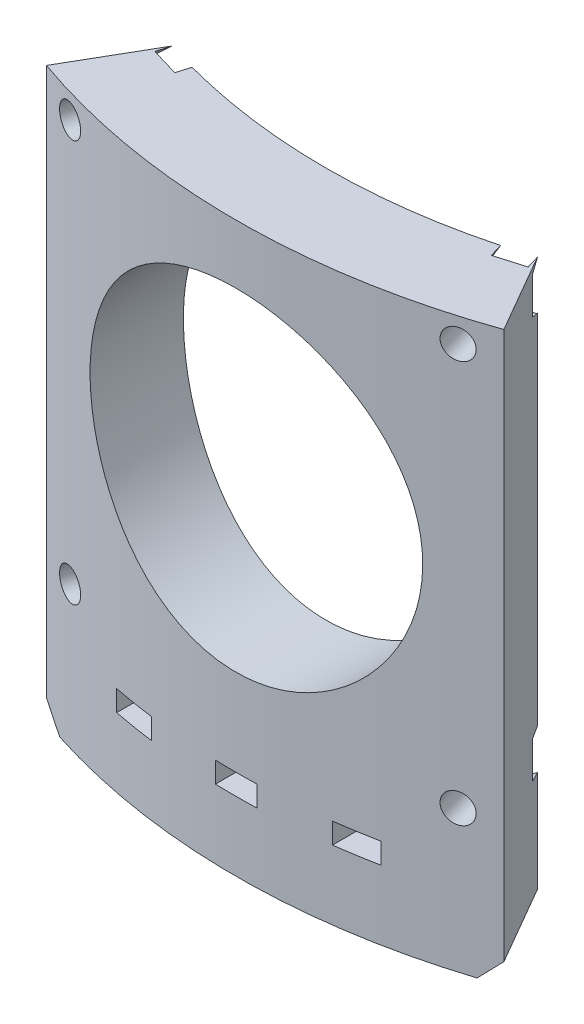
from build123d import *

# Parameters (mm, degrees)
EXTRUDE_1_DEPTH          = 82
SKETCH_2_R               = 1.75
CUT_EXTRUDE_1_DEPTH      = 20
SKETCH_3_W               = 6
SKETCH_3_H               = 3
CUT_EXTRUDE_2_DEPTH      = 91.038245833
SKETCH_4_R               = 24
CUT_EXTRUDE_3_DEPTH      = 91.038245833
CHAMFER_1_SIZE           = 3
SKETCH_10_R              = 2.25
CUT_EXTRUDE_5_DEPTH      = 104.037059953
SKETCH_11_R              = 2.1
CUT_EXTRUDE_6_DEPTH      = 104.037059953
CUT_EXTRUDE_7_DEPTH      = 2
CUT_EXTRUDE_7_DEPTH_BACK = 2
CUT_EXTRUDE_8_DEPTH      = 2
CUT_EXTRUDE_8_DEPTH_BACK = 2


with BuildPart() as part:
    # Эскиз1 → Бобышка-Вытянуть1 (new body)
    with BuildSketch(Plane(origin=(0, 0, 0), x_dir=(-1, 0, 0), z_dir=(0, 1, 0))):
        with BuildLine():
            Line((33, 7.338095117), (26.371331686, -4.14309519))
            ThreePointArc((26.371331686, -4.14309519), (0, 0), (-26.371331686, -4.14309519))
            Line((-26.371331686, -4.14309519), (-33, 7.338095117))
            ThreePointArc((-33, 7.338095117), (0, 13), (33, 7.338095117))
        make_face()
    extrude(amount=EXTRUDE_1_DEPTH)

    # Эскиз2 → Вырез-Вытянуть1 (cut)
    with BuildSketch(Plane.XZ):
        with Locations((0, 6.5)):
            Circle(SKETCH_2_R)
        with Locations((16.060870766, 5.085724384)):
            Circle(SKETCH_2_R)
        with Locations((-16.060870766, 5.085724384)):
            Circle(SKETCH_2_R)
    extrude(amount=-CUT_EXTRUDE_1_DEPTH, mode=Mode.SUBTRACT)

    # Эскиз3 → Вырез-Вытянуть2 (cut, through all)
    with BuildSketch(Plane.XY.offset(13)):
        with Locations((-16.060870766, 11.5)):
            Rectangle(SKETCH_3_W, SKETCH_3_H)
        with Locations((0, 11.5)):
            Rectangle(SKETCH_3_W, SKETCH_3_H)
        with Locations((16.060870766, 11.5)):
            Rectangle(SKETCH_3_W, SKETCH_3_H)
    extrude(amount=-CUT_EXTRUDE_2_DEPTH, mode=Mode.SUBTRACT)

    # Эскиз4 → Вырез-Вытянуть3 (cut, through all)
    with BuildSketch(Plane.XY.offset(13)):
        with Locations((0, 49.5)):
            Circle(SKETCH_4_R)
    extrude(amount=-CUT_EXTRUDE_3_DEPTH, mode=Mode.SUBTRACT)

    # Фаска1
    chamfer_1_edges = [part.edges().sort_by_distance(p)[0] for p in [
        (29.685665843, 0, 1.597499963),
        (-29.685665843, 0, 1.597499963),
    ]]
    chamfer(chamfer_1_edges, length=CHAMFER_1_SIZE)

    # Эскиз10 → Вырез-Вытянуть5 (cut, through all)
    with BuildSketch(Plane(origin=(-28, 82, 8.957885402), x_dir=(0.9591705596151331, 0, 0.28282828282827793), z_dir=(-0.28282828282827793, 0, 0.9591705596151331))):
        with Locations((0, -3.5)):
            Circle(SKETCH_10_R)
        with Locations((0, -61.5)):
            Circle(SKETCH_10_R)
    extrude(amount=-CUT_EXTRUDE_5_DEPTH, mode=Mode.SUBTRACT)

    # Эскиз11 → Вырез-Вытянуть6 (cut, through all)
    with BuildSketch(Plane(origin=(28, 82, 8.957885402), x_dir=(0.9591705596151305, 0, -0.28282828282828665), z_dir=(0.28282828282828665, 0, 0.9591705596151305))):
        with Locations((0, -3.5)):
            Circle(SKETCH_11_R)
        with Locations((0, -61.5)):
            Circle(SKETCH_11_R)
    extrude(amount=-CUT_EXTRUDE_6_DEPTH, mode=Mode.SUBTRACT)

    # Эскиз13 → Вырез-Вытянуть7 (cut, two sides: drawn at the far end of the back side and taken through both)
    with BuildSketch(Plane(origin=(-0.985550088, 0, 3.342348296), x_dir=(0.9591705596151331, 0, 0.28282828282827793), z_dir=(-0.28282828282827793, 0, 0.9591705596151331)).offset(-CUT_EXTRUDE_7_DEPTH_BACK)):
        Polygon((-24.323232323, 24.656921938), (-27.923232323, 22.578460969), (-27.923232323, 18.421539031), (-24.323232323, 16.343078062), (-20.723232323, 18.421539031), (-20.723232323, 22.578460969), align=None)
        Polygon((-22.244771354, 74.9), (-20.166310385, 78.5), (-22.244771354, 82.1), (-26.401693292, 82.1), (-28.480154261, 78.5), (-26.401693292, 74.9), align=None)
    extrude(amount=CUT_EXTRUDE_7_DEPTH + CUT_EXTRUDE_7_DEPTH_BACK, mode=Mode.SUBTRACT)

    # Эскиз14 → Вырез-Вытянуть8 (cut, two sides: drawn at the far end of the back side and taken through both)
    with BuildSketch(Plane(origin=(0.985550088, 0, 3.342348296), x_dir=(0.9591705596151305, 0, -0.28282828282828665), z_dir=(0.28282828282828665, 0, 0.9591705596151305)).offset(-CUT_EXTRUDE_8_DEPTH_BACK)):
        Polygon((28.480154261, 78.5), (26.401693292, 82.1), (22.244771354, 82.1), (20.166310385, 78.5), (22.244771354, 74.9), (26.401693292, 74.9), align=None)
        Polygon((24.323232323, 24.656921938), (20.723232323, 22.578460969), (20.723232323, 18.421539031), (24.323232323, 16.343078062), (27.923232323, 18.421539031), (27.923232323, 22.578460969), align=None)
    extrude(amount=CUT_EXTRUDE_8_DEPTH + CUT_EXTRUDE_8_DEPTH_BACK, mode=Mode.SUBTRACT)


solid = part.part
